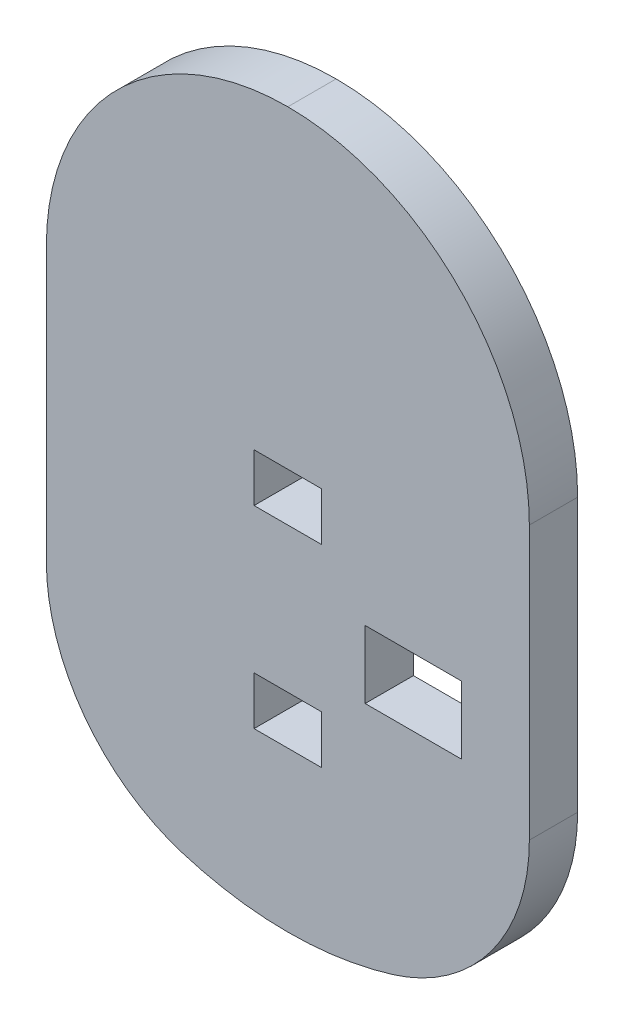
from build123d import *

# Parameters (mm, degrees)
SKETCH1_R           = 37
BOSS_EXTRUDE1_DEPTH = 5
CUT_EXTRUDE3_START  = -10
CUT_EXTRUDE3_DEPTH  = 10
FILLET1_R           = 25
FILLET2_R           = 20
SKETCH11_W          = 7
SKETCH11_H          = 5
CUT_EXTRUDE4_DEPTH  = 10
SKETCH12_W          = 10
SKETCH12_H          = 7
CUT_EXTRUDE5_DEPTH  = 10


with BuildPart() as part:
    # Sketch1 → Boss-Extrude1 (new body)
    with BuildSketch(Plane.XY):
        Circle(SKETCH1_R)
    extrude(amount=BOSS_EXTRUDE1_DEPTH)

    # Sketch10 → Cut-Extrude3 (cut)
    with BuildSketch(Plane.XY.offset(5).offset(CUT_EXTRUDE3_START)):
        with BuildLine():
            Line((-25, 27.276363394), (-25, -27.276363394))
            ThreePointArc((-25, -27.276363394), (-37, 0), (-25, 27.276363394))
        make_face()
        with BuildLine():
            Line((25, -27.276363394), (25, 27.276363394))
            ThreePointArc((25, 27.276363394), (37, 0), (25, -27.276363394))
        make_face()
    extrude(amount=CUT_EXTRUDE3_DEPTH, mode=Mode.SUBTRACT)

    # Fillet1
    fillet1_edges = [part.edges().sort_by_distance(p)[0] for p in [
        (-25, 27.276363394, 2.5),
        (25, 27.276363394, 2.5),
    ]]
    fillet(fillet1_edges, radius=FILLET1_R - 0.0001)  # a hair under: the kernel refuses the full size

    # Fillet2
    fillet2_edges = [part.edges().sort_by_distance(p)[0] for p in [
        (-25, -27.276363394, 2.5),
        (25, -27.276363394, 2.5),
    ]]
    fillet(fillet2_edges, radius=FILLET2_R)

    # Sketch11 → Cut-Extrude4 (cut)
    with BuildSketch(Plane.XY.offset(5)):
        with Locations((0, 2)):
            Rectangle(SKETCH11_W, SKETCH11_H)
        with Locations((0, -18)):
            Rectangle(SKETCH11_W, SKETCH11_H)
    extrude(amount=-CUT_EXTRUDE4_DEPTH, mode=Mode.SUBTRACT)

    # Sketch12 → Cut-Extrude5 (cut)
    with BuildSketch(Plane.XY.offset(5)):
        with Locations((13, -9)):
            Rectangle(SKETCH12_W, SKETCH12_H)
    extrude(amount=-CUT_EXTRUDE5_DEPTH, mode=Mode.SUBTRACT)


solid = part.part
